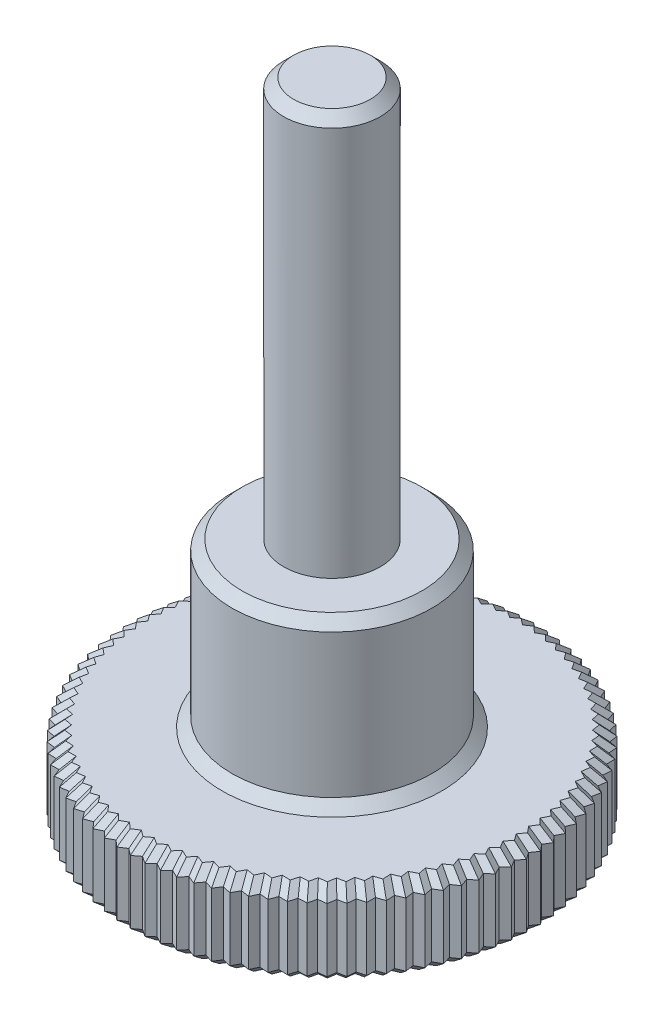
from build123d import *

# Parameters (mm, degrees)
EXTRUDE1_DEPTH = 2.5
SKETCH2_R      = 3
EXTRUDE2_DEPTH = 4.9
SKETCH3_R      = 1.45
EXTRUDE3_DEPTH = 12
CHAMFER1_SIZE  = 0.3


with BuildPart() as part:
    # Sketch1 → Extrude1 (new body)
    with BuildSketch(Plane(origin=(0, 0, 0), x_dir=(1, 0, 0), z_dir=(0, 1, 0))):
        Polygon((0.205816144, 5.893803219), (0, 6.05), (-0.205816144, 5.893803219), (-0.422026666, 6.035262504), (-0.616445715, 5.865089202), (-0.841997261, 5.991121816), (-1.024072025, 5.80780106), (-1.257865729, 5.917792984), (-1.42670916, 5.722217895), (-1.667606003, 5.81563326), (-1.82239551, 5.60875666), (-2.069221867, 5.685140356), (-2.209203333, 5.467970126), (-2.460756691, 5.526950019), (-2.585248139, 5.300544191), (-2.840302955, 5.341832937), (-2.948697876, 5.107294538), (-3.206011549, 5.130690982), (-3.297781854, 4.889162659), (-3.556100776, 4.894552816), (-3.63079937, 4.647211271), (-3.888865039, 4.634568881), (-3.946127996, 4.382619137), (-4.202683141, 4.352005792), (-4.242231483, 4.096675324), (-4.496026194, 4.048240168), (-4.517667245, 3.790772919), (-4.767465059, 3.724751926), (-4.771093387, 3.46640225), (-5.015677314, 3.383117066), (-5.00127524, 3.125143618), (-5.239453693, 3.025), (-5.207091384, 2.7686596), (-5.43770398, 2.652145438), (-5.387539102, 2.398686951), (-5.60946232, 2.26636989), (-5.541739271, 2.017028141), (-5.753891924, 1.869552816), (-5.668940643, 1.625542571), (-5.870289144, 1.463627468), (-5.768523506, 1.226137522), (-5.958086906, 1.050571475), (-5.840002703, 0.820758854), (-6.016857467, 0.632397203), (-5.883029993, 0.411381532), (-6.046314503, 0.211141955), (-5.897395753, 0), (-6.046314503, -0.211141955), (-5.883029993, -0.411381532), (-6.016857467, -0.632397203), (-5.840002703, -0.820758854), (-5.958086906, -1.050571475), (-5.768523506, -1.226137522), (-5.870289144, -1.463627468), (-5.668940643, -1.625542571), (-5.753891924, -1.869552816), (-5.541739271, -2.017028141), (-5.60946232, -2.26636989), (-5.387539102, -2.398686951), (-5.43770398, -2.652145438), (-5.207091384, -2.7686596), (-5.239453693, -3.025), (-5.00127524, -3.125143618), (-5.015677314, -3.383117066), (-4.771093387, -3.46640225), (-4.767465059, -3.724751926), (-4.517667245, -3.790772919), (-4.496026194, -4.048240168), (-4.242231483, -4.096675324), (-4.202683141, -4.352005792), (-3.946127996, -4.382619137), (-3.888865039, -4.634568881), (-3.63079937, -4.647211271), (-3.556100776, -4.894552816), (-3.297781854, -4.889162659), (-3.206011549, -5.130690982), (-2.948697876, -5.107294538), (-2.840302955, -5.341832937), (-2.585248139, -5.300544191), (-2.460756691, -5.526950019), (-2.209203333, -5.467970126), (-2.069221867, -5.685140356), (-1.82239551, -5.60875666), (-1.667606003, -5.81563326), (-1.42670916, -5.722217895), (-1.257865729, -5.917792984), (-1.024072025, -5.80780106), (-0.841997261, -5.991121816), (-0.616445715, -5.865089202), (-0.422026666, -6.035262504), (-0.205816144, -5.893803219), (0, -6.05), (0.205816144, -5.893803219), (0.422026666, -6.035262504), (0.616445715, -5.865089202), (0.841997261, -5.991121816), (1.024072025, -5.80780106), (1.257865729, -5.917792984), (1.42670916, -5.722217895), (1.667606003, -5.81563326), (1.82239551, -5.60875666), (2.069221867, -5.685140356), (2.209203333, -5.467970126), (2.460756691, -5.526950019), (2.585248139, -5.300544191), (2.840302955, -5.341832937), (2.948697876, -5.107294538), (3.206011549, -5.130690982), (3.297781854, -4.889162659), (3.556100776, -4.894552816), (3.63079937, -4.647211271), (3.888865039, -4.634568881), (3.946127996, -4.382619137), (4.202683141, -4.352005792), (4.242231483, -4.096675324), (4.496026194, -4.048240168), (4.517667245, -3.790772919), (4.767465059, -3.724751926), (4.771093387, -3.46640225), (5.015677314, -3.383117066), (5.00127524, -3.125143618), (5.239453693, -3.025), (5.207091384, -2.7686596), (5.43770398, -2.652145438), (5.387539102, -2.398686951), (5.60946232, -2.26636989), (5.541739271, -2.017028141), (5.753891924, -1.869552816), (5.668940643, -1.625542571), (5.870289144, -1.463627468), (5.768523506, -1.226137522), (5.958086906, -1.050571475), (5.840002703, -0.820758854), (6.016857467, -0.632397203), (5.883029993, -0.411381532), (6.046314503, -0.211141955), (5.897395753, 0), (6.046314503, 0.211141955), (5.883029993, 0.411381532), (6.016857467, 0.632397203), (5.840002703, 0.820758854), (5.958086906, 1.050571475), (5.768523506, 1.226137522), (5.870289144, 1.463627468), (5.668940643, 1.625542571), (5.753891924, 1.869552816), (5.541739271, 2.017028141), (5.60946232, 2.26636989), (5.387539102, 2.398686951), (5.43770398, 2.652145438), (5.207091384, 2.7686596), (5.239453693, 3.025), (5.00127524, 3.125143618), (5.015677314, 3.383117066), (4.771093387, 3.46640225), (4.767465059, 3.724751926), (4.517667245, 3.790772919), (4.496026194, 4.048240168), (4.242231483, 4.096675324), (4.202683141, 4.352005792), (3.946127996, 4.382619137), (3.888865039, 4.634568881), (3.63079937, 4.647211271), (3.556100776, 4.894552816), (3.297781854, 4.889162659), (3.206011549, 5.130690982), (2.948697876, 5.107294538), (2.840302955, 5.341832937), (2.585248139, 5.300544191), (2.460756691, 5.526950019), (2.209203333, 5.467970126), (2.069221867, 5.685140356), (1.82239551, 5.60875666), (1.667606003, 5.81563326), (1.42670916, 5.722217895), (1.257865729, 5.917792984), (1.024072025, 5.80780106), (0.841997261, 5.991121816), (0.616445715, 5.865089202), (0.422026666, 6.035262504), align=None)
    extrude(amount=EXTRUDE1_DEPTH)

    # Sketch2 → Extrude2 (add)
    with BuildSketch(Plane(origin=(0, 2.5, 0), x_dir=(1, 0, 0), z_dir=(0, 1, 0))):
        Circle(SKETCH2_R)
    extrude(amount=EXTRUDE2_DEPTH)

    # Sketch3 → Extrude3 (add)
    with BuildSketch(Plane(origin=(0, 7.4, 0), x_dir=(1, 0, 0), z_dir=(0, 1, 0))):
        Circle(SKETCH3_R)
    extrude(amount=EXTRUDE3_DEPTH)

    # Chamfer1
    chamfer1_edges = [part.edges().sort_by_distance(p)[0] for p in [
        (0.313921405, 2.5, -5.964532861),
        (0.519236191, 2.5, -5.950175853),
        (0.729221488, 2.5, -5.928105509),
        (0.933034643, 2.5, -5.899461438),
        (1.140968877, 2.5, -5.862797022),
        (1.342287445, 2.5, -5.82000544),
        (1.547157581, 2.5, -5.768925578),
        (1.745000756, 2.5, -5.71219496),
        (1.945808689, 2.5, -5.646948508),
        (2.1392126, 2.5, -5.576555241),
        (2.334980012, 2.5, -5.497460072),
        (2.523002415, 2.5, -5.413747105),
        (2.712775547, 2.5, -5.321188564),
        (2.894500416, 2.5, -5.224563737),
        (3.077354712, 2.5, -5.11899276),
        (3.251896701, 2.5, -5.00992682),
        (3.426941315, 2.5, -4.891857738),
        (3.593450073, 2.5, -4.770882044),
        (3.759832204, 2.5, -4.640890076),
        (3.917496517, 2.5, -4.508594009),
        (4.074405569, 2.5, -4.367312465),
        (4.222457312, 2.5, -4.224340558),
        (4.369128839, 2.5, -4.072457746),
        (4.50684672, 2.5, -3.919506544),
        (4.642566152, 2.5, -3.757762422),
        (4.769279223, 2.5, -3.595577088),
        (4.89338535, 2.5, -3.424759658),
        (5.008476277, 2.5, -3.254130342),
        (5.120364467, 2.5, -3.075071809),
        (5.223272538, 2.5, -2.8968298),
        (5.322397682, 2.5, -2.710402519),
        (5.412621541, 2.5, -2.525416195),
        (5.498500711, 2.5, -2.332528421),
        (5.575600795, 2.5, -2.141699015),
        (5.647815597, 2.5, -1.943290478),
        (5.711416283, 2.5, -1.747547694),
        (5.769614893, 2.5, -1.54458502),
        (5.819406325, 2.5, -1.344882495),
        (5.863305206, 2.5, -1.138354499),
        (5.899044804, 2.5, -0.935665165),
        (5.928430085, 2.5, -0.726578029),
        (5.94994373, 2.5, -0.521889367),
        (5.964672248, 2.5, -0.311261744),
        (5.971855128, 2.5, -0.105570978),
        (5.971855128, 2.5, 0.105570978),
        (5.964672248, 2.5, 0.311261744),
        (5.94994373, 2.5, 0.521889367),
        (5.928430085, 2.5, 0.726578029),
        (5.899044804, 2.5, 0.935665165),
        (5.863305206, 2.5, 1.138354499),
        (5.819406325, 2.5, 1.344882495),
        (5.769614893, 2.5, 1.54458502),
        (5.711416283, 2.5, 1.747547694),
        (5.647815597, 2.5, 1.943290478),
        (5.575600795, 2.5, 2.141699015),
        (5.498500711, 2.5, 2.332528421),
        (5.412621541, 2.5, 2.525416195),
        (5.322397682, 2.5, 2.710402519),
        (5.223272538, 2.5, 2.8968298),
        (5.120364467, 2.5, 3.075071809),
        (5.008476277, 2.5, 3.254130342),
        (4.89338535, 2.5, 3.424759658),
        (4.769279223, 2.5, 3.595577088),
        (4.642566152, 2.5, 3.757762422),
        (4.50684672, 2.5, 3.919506544),
        (4.369128839, 2.5, 4.072457746),
        (4.222457312, 2.5, 4.224340558),
        (4.074405569, 2.5, 4.367312465),
        (3.917496517, 2.5, 4.508594009),
        (3.759832204, 2.5, 4.640890076),
        (3.593450073, 2.5, 4.770882044),
        (3.426941315, 2.5, 4.891857738),
        (3.251896701, 2.5, 5.00992682),
        (3.077354712, 2.5, 5.11899276),
        (2.894500416, 2.5, 5.224563737),
        (2.712775547, 2.5, 5.321188564),
        (2.523002415, 2.5, 5.413747105),
        (2.334980012, 2.5, 5.497460072),
        (2.1392126, 2.5, 5.576555241),
        (1.945808689, 2.5, 5.646948508),
        (1.745000756, 2.5, 5.71219496),
        (1.547157581, 2.5, 5.768925578),
        (1.342287445, 2.5, 5.82000544),
        (1.140968877, 2.5, 5.862797022),
        (0.933034643, 2.5, 5.899461438),
        (0.729221488, 2.5, 5.928105509),
        (0.519236191, 2.5, 5.950175853),
        (0.313921405, 2.5, 5.964532861),
        (0.102908072, 2.5, 5.971901609),
        (-0.102908072, 2.5, 5.971901609),
        (-0.313921405, 2.5, 5.964532861),
        (-0.519236191, 2.5, 5.950175853),
        (-0.729221488, 2.5, 5.928105509),
        (-0.933034643, 2.5, 5.899461438),
        (-1.140968877, 2.5, 5.862797022),
        (-1.342287445, 2.5, 5.82000544),
        (-1.547157581, 2.5, 5.768925578),
        (-1.745000756, 2.5, 5.71219496),
        (-1.945808689, 2.5, 5.646948508),
        (-2.1392126, 2.5, 5.576555241),
        (-2.334980012, 2.5, 5.497460072),
        (-2.523002415, 2.5, 5.413747105),
        (-2.712775547, 2.5, 5.321188564),
        (-2.894500416, 2.5, 5.224563737),
        (-3.077354712, 2.5, 5.11899276),
        (-3.251896701, 2.5, 5.00992682),
        (-3.426941315, 2.5, 4.891857738),
        (-3.593450073, 2.5, 4.770882044),
        (-3.759832204, 2.5, 4.640890076),
        (-3.917496517, 2.5, 4.508594009),
        (-4.074405569, 2.5, 4.367312465),
        (-4.222457312, 2.5, 4.224340558),
        (-4.369128839, 2.5, 4.072457746),
        (-4.50684672, 2.5, 3.919506544),
        (-4.642566152, 2.5, 3.757762422),
        (-4.769279223, 2.5, 3.595577088),
        (-4.89338535, 2.5, 3.424759658),
        (-5.008476277, 2.5, 3.254130342),
        (-5.120364467, 2.5, 3.075071809),
        (-5.223272538, 2.5, 2.8968298),
        (-5.322397682, 2.5, 2.710402519),
        (-5.412621541, 2.5, 2.525416195),
        (-5.498500711, 2.5, 2.332528421),
        (-5.575600795, 2.5, 2.141699015),
        (-5.647815597, 2.5, 1.943290478),
        (-5.711416283, 2.5, 1.747547694),
        (-5.769614893, 2.5, 1.54458502),
        (-5.819406325, 2.5, 1.344882495),
        (-5.863305206, 2.5, 1.138354499),
        (-5.899044804, 2.5, 0.935665165),
        (-5.928430085, 2.5, 0.726578029),
        (-5.94994373, 2.5, 0.521889367),
        (-5.964672248, 2.5, 0.311261744),
        (-5.971855128, 2.5, 0.105570978),
        (-5.971855128, 2.5, -0.105570978),
        (-5.964672248, 2.5, -0.311261744),
        (-5.94994373, 2.5, -0.521889367),
        (-5.928430085, 2.5, -0.726578029),
        (-5.899044804, 2.5, -0.935665165),
        (-5.863305206, 2.5, -1.138354499),
        (-5.819406325, 2.5, -1.344882495),
        (-5.769614893, 2.5, -1.54458502),
        (-5.711416283, 2.5, -1.747547694),
        (-5.647815597, 2.5, -1.943290478),
        (-5.575600795, 2.5, -2.141699015),
        (-5.498500711, 2.5, -2.332528421),
        (-5.412621541, 2.5, -2.525416195),
        (-5.322397682, 2.5, -2.710402519),
        (-5.223272538, 2.5, -2.8968298),
        (-5.120364467, 2.5, -3.075071809),
        (-5.008476277, 2.5, -3.254130342),
        (-4.89338535, 2.5, -3.424759658),
        (-4.769279223, 2.5, -3.595577088),
        (-4.642566152, 2.5, -3.757762422),
        (-4.50684672, 2.5, -3.919506544),
        (-4.369128839, 2.5, -4.072457746),
        (-4.222457312, 2.5, -4.224340558),
        (-4.074405569, 2.5, -4.367312465),
        (-3.917496517, 2.5, -4.508594009),
        (-3.759832204, 2.5, -4.640890076),
        (-3.593450073, 2.5, -4.770882044),
        (-3.426941315, 2.5, -4.891857738),
        (-3.251896701, 2.5, -5.00992682),
        (-3.077354712, 2.5, -5.11899276),
        (-2.894500416, 2.5, -5.224563737),
        (-2.712775547, 2.5, -5.321188564),
        (-2.523002415, 2.5, -5.413747105),
        (-2.334980012, 2.5, -5.497460072),
        (-2.1392126, 2.5, -5.576555241),
        (-1.945808689, 2.5, -5.646948508),
        (-1.745000756, 2.5, -5.71219496),
        (-1.547157581, 2.5, -5.768925578),
        (-1.342287445, 2.5, -5.82000544),
        (-1.140968877, 2.5, -5.862797022),
        (-0.933034643, 2.5, -5.899461438),
        (-0.729221488, 2.5, -5.928105509),
        (-0.519236191, 2.5, -5.950175853),
        (-0.313921405, 2.5, -5.964532861),
        (-0.102908072, 2.5, -5.971901609),
        (0.102908072, 2.5, -5.971901609),
        (-3, 2.5, 0),
        (-0.102908072, 0, -5.971901609),
        (-0.313921405, 0, -5.964532861),
        (-0.519236191, 0, -5.950175853),
        (-0.729221488, 0, -5.928105509),
        (-0.933034643, 0, -5.899461438),
        (-1.140968877, 0, -5.862797022),
        (-1.342287445, 0, -5.82000544),
        (-1.547157581, 0, -5.768925578),
        (-1.745000756, 0, -5.71219496),
        (-1.945808689, 0, -5.646948508),
        (-2.1392126, 0, -5.576555241),
        (-2.334980012, 0, -5.497460072),
        (-2.523002415, 0, -5.413747105),
        (-2.712775547, 0, -5.321188564),
        (-2.894500416, 0, -5.224563737),
        (-3.077354712, 0, -5.11899276),
        (-3.251896701, 0, -5.00992682),
        (-3.426941315, 0, -4.891857738),
        (-3.593450073, 0, -4.770882044),
        (-3.759832204, 0, -4.640890076),
        (-3.917496517, 0, -4.508594009),
        (-4.074405569, 0, -4.367312465),
        (-4.222457312, 0, -4.224340558),
        (-4.369128839, 0, -4.072457746),
        (-4.50684672, 0, -3.919506544),
        (-4.642566152, 0, -3.757762422),
        (-4.769279223, 0, -3.595577088),
        (-4.89338535, 0, -3.424759658),
        (-5.008476277, 0, -3.254130342),
        (-5.120364467, 0, -3.075071809),
        (-5.223272538, 0, -2.8968298),
        (-5.322397682, 0, -2.710402519),
        (-5.412621541, 0, -2.525416195),
        (-5.498500711, 0, -2.332528421),
        (-5.575600795, 0, -2.141699015),
        (-5.647815597, 0, -1.943290478),
        (-5.711416283, 0, -1.747547694),
        (-5.769614893, 0, -1.54458502),
        (-5.819406325, 0, -1.344882495),
        (-5.863305206, 0, -1.138354499),
        (-5.899044804, 0, -0.935665165),
        (-5.928430085, 0, -0.726578029),
        (-5.94994373, 0, -0.521889367),
        (-5.964672248, 0, -0.311261744),
        (-5.971855128, 0, -0.105570978),
        (-5.971855128, 0, 0.105570978),
        (-5.964672248, 0, 0.311261744),
        (-5.94994373, 0, 0.521889367),
        (-5.928430085, 0, 0.726578029),
        (-5.899044804, 0, 0.935665165),
        (-5.863305206, 0, 1.138354499),
        (-5.819406325, 0, 1.344882495),
        (-5.769614893, 0, 1.54458502),
        (-5.711416283, 0, 1.747547694),
        (-5.647815597, 0, 1.943290478),
        (-5.575600795, 0, 2.141699015),
        (-5.498500711, 0, 2.332528421),
        (-5.412621541, 0, 2.525416195),
        (-5.322397682, 0, 2.710402519),
        (-5.223272538, 0, 2.8968298),
        (-5.120364467, 0, 3.075071809),
        (-5.008476277, 0, 3.254130342),
        (-4.89338535, 0, 3.424759658),
        (-4.769279223, 0, 3.595577088),
        (-4.642566152, 0, 3.757762422),
        (-4.50684672, 0, 3.919506544),
        (-4.369128839, 0, 4.072457746),
        (-4.222457312, 0, 4.224340558),
        (-4.074405569, 0, 4.367312465),
        (-3.917496517, 0, 4.508594009),
        (-3.759832204, 0, 4.640890076),
        (-3.593450073, 0, 4.770882044),
        (-3.426941315, 0, 4.891857738),
        (-3.251896701, 0, 5.00992682),
        (-3.077354712, 0, 5.11899276),
        (-2.894500416, 0, 5.224563737),
        (-2.712775547, 0, 5.321188564),
        (-2.523002415, 0, 5.413747105),
        (-2.334980012, 0, 5.497460072),
        (-2.1392126, 0, 5.576555241),
        (-1.945808689, 0, 5.646948508),
        (-1.745000756, 0, 5.71219496),
        (-1.547157581, 0, 5.768925578),
        (-1.342287445, 0, 5.82000544),
        (-1.140968877, 0, 5.862797022),
        (-0.933034643, 0, 5.899461438),
        (-0.729221488, 0, 5.928105509),
        (-0.519236191, 0, 5.950175853),
        (-0.313921405, 0, 5.964532861),
        (-0.102908072, 0, 5.971901609),
        (0.102908072, 0, 5.971901609),
        (0.313921405, 0, 5.964532861),
        (0.519236191, 0, 5.950175853),
        (0.729221488, 0, 5.928105509),
        (0.933034643, 0, 5.899461438),
        (1.140968877, 0, 5.862797022),
        (1.342287445, 0, 5.82000544),
        (1.547157581, 0, 5.768925578),
        (1.745000756, 0, 5.71219496),
        (1.945808689, 0, 5.646948508),
        (2.1392126, 0, 5.576555241),
        (2.334980012, 0, 5.497460072),
        (2.523002415, 0, 5.413747105),
        (2.712775547, 0, 5.321188564),
        (2.894500416, 0, 5.224563737),
        (3.077354712, 0, 5.11899276),
        (3.251896701, 0, 5.00992682),
        (3.426941315, 0, 4.891857738),
        (3.593450073, 0, 4.770882044),
        (3.759832204, 0, 4.640890076),
        (3.917496517, 0, 4.508594009),
        (4.074405569, 0, 4.367312465),
        (4.222457312, 0, 4.224340558),
        (4.369128839, 0, 4.072457746),
        (4.50684672, 0, 3.919506544),
        (4.642566152, 0, 3.757762422),
        (4.769279223, 0, 3.595577088),
        (4.89338535, 0, 3.424759658),
        (5.008476277, 0, 3.254130342),
        (5.120364467, 0, 3.075071809),
        (5.223272538, 0, 2.8968298),
        (5.322397682, 0, 2.710402519),
        (5.412621541, 0, 2.525416195),
        (5.498500711, 0, 2.332528421),
        (5.575600795, 0, 2.141699015),
        (5.647815597, 0, 1.943290478),
        (5.711416283, 0, 1.747547694),
        (5.769614893, 0, 1.54458502),
        (5.819406325, 0, 1.344882495),
        (5.863305206, 0, 1.138354499),
        (5.899044804, 0, 0.935665165),
        (5.928430085, 0, 0.726578029),
        (5.94994373, 0, 0.521889367),
        (5.964672248, 0, 0.311261744),
        (5.971855128, 0, 0.105570978),
        (5.971855128, 0, -0.105570978),
        (5.964672248, 0, -0.311261744),
        (5.94994373, 0, -0.521889367),
        (5.928430085, 0, -0.726578029),
        (5.899044804, 0, -0.935665165),
        (5.863305206, 0, -1.138354499),
        (5.819406325, 0, -1.344882495),
        (5.769614893, 0, -1.54458502),
        (5.711416283, 0, -1.747547694),
        (5.647815597, 0, -1.943290478),
        (5.575600795, 0, -2.141699015),
        (5.498500711, 0, -2.332528421),
        (5.412621541, 0, -2.525416195),
        (5.322397682, 0, -2.710402519),
        (5.223272538, 0, -2.8968298),
        (5.120364467, 0, -3.075071809),
        (5.008476277, 0, -3.254130342),
        (4.89338535, 0, -3.424759658),
        (4.769279223, 0, -3.595577088),
        (4.642566152, 0, -3.757762422),
        (4.50684672, 0, -3.919506544),
        (4.369128839, 0, -4.072457746),
        (4.222457312, 0, -4.224340558),
        (4.074405569, 0, -4.367312465),
        (3.917496517, 0, -4.508594009),
        (3.759832204, 0, -4.640890076),
        (3.593450073, 0, -4.770882044),
        (3.426941315, 0, -4.891857738),
        (3.251896701, 0, -5.00992682),
        (3.077354712, 0, -5.11899276),
        (2.894500416, 0, -5.224563737),
        (2.712775547, 0, -5.321188564),
        (2.523002415, 0, -5.413747105),
        (2.334980012, 0, -5.497460072),
        (2.1392126, 0, -5.576555241),
        (1.945808689, 0, -5.646948508),
        (1.745000756, 0, -5.71219496),
        (1.547157581, 0, -5.768925578),
        (1.342287445, 0, -5.82000544),
        (1.140968877, 0, -5.862797022),
        (0.933034643, 0, -5.899461438),
        (0.729221488, 0, -5.928105509),
        (0.519236191, 0, -5.950175853),
        (0.313921405, 0, -5.964532861),
        (0.102908072, 0, -5.971901609),
        (-1.45, 19.4, 0),
        (-3, 7.4, 0),
    ]]
    chamfer(chamfer1_edges, length=CHAMFER1_SIZE)


solid = part.part
